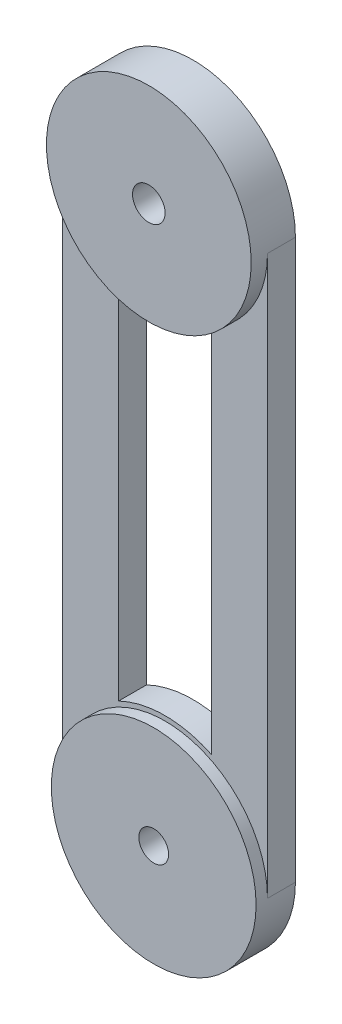
from build123d import *
from build123d.topology import SkipClean

# Parameters (mm, degrees)
BOSS_EXTRUDE1_DEPTH           = 3
BOSS_EXTRUDE2_START           = -1.75
SKETCH1_3_R                   = 11
BOSS_EXTRUDE2_DEPTH           = 1.75
SKETCH2_R                     = 1.75
CUT_EXTRUDE1_DEPTH            = 4.75
SKETCH2_3_R                   = 3
CUT_EXTRUDE2_DEPTH            = 1.75
BOSS_EXTRUDE3_START           = -1.225
SKETCH1_4_R                   = 11
BOSS_EXTRUDE3_DEPTH           = 1.225
SKETCH3_R                     = 1.6
CUT_EXTRUDE3_DEPTH            = 4.225
SKETCH3_3_R                   = 3
SKETCH3_3_R_2                 = 1.6
CUT_EXTRUDE4_DEPTH            = 1.225
BODY_MOVE_COPY1_DEPTH         = 3
BODY_MOVE_COPY1_START         = 1.75
BODY_MOVE_COPY1_2_OUTLINE_R   = 11
BODY_MOVE_COPY1_2_OUTLINE_R_2 = 1.6
BODY_MOVE_COPY1_2_OUTLINE_R_3 = 3
BODY_MOVE_COPY1_2_DEPTH       = 1.25
BODY_MOVE_COPY1_START_2       = 1.225
BODY_MOVE_COPY1_3_OUTLINE_R   = 11
BODY_MOVE_COPY1_3_OUTLINE_R_2 = 1.6
BODY_MOVE_COPY1_3_DEPTH       = 0.525
BODY_MOVE_COPY1_START_3       = -1.75
BODY_MOVE_COPY1_4_OUTLINE_R   = 3
BODY_MOVE_COPY1_4_OUTLINE_R_2 = 1.75
BODY_MOVE_COPY1_4_DEPTH       = 0.5
BODY_MOVE_COPY1_START_4       = -3
BODY_MOVE_COPY1_5_OUTLINE_R   = 3
BODY_MOVE_COPY1_5_DEPTH       = 3
BODY_MOVE_COPY1_START_5       = -1.775
BODY_MOVE_COPY1_6_OUTLINE_R   = 3
BODY_MOVE_COPY1_6_OUTLINE_R_2 = 1.6
BODY_MOVE_COPY1_6_DEPTH       = 0.55
BODY_MOVE_COPY1_START_6       = 1.25
BODY_MOVE_COPY1_7_OUTLINE_R   = 3
BODY_MOVE_COPY1_7_OUTLINE_R_2 = 1.75
BODY_MOVE_COPY1_7_DEPTH       = 0.5


# Read off the part's stored shape, not the designer's step: Body-Move/Copy1
with BuildPart() as part:
    # Sketch1 → Boss-Extrude1 (new body)
    with BuildSketch(Plane.XY):
        with BuildLine():
            Line((-11, 30), (-11, -30))
            ThreePointArc((-11, -30), (0, -41), (11, -30))
            Line((11, -30), (11, 30))
            ThreePointArc((11, 30), (0, 41), (-11, 30))
        make_face()
        with BuildLine():
            ThreePointArc((5, -19.643842411), (0, -18.5), (-5, -19.643842411))
            Line((-5, -19.643842411), (-5, 19.643842411))
            ThreePointArc((-5, 19.643842411), (0, 18.5), (5, 19.643842411))
            Line((5, 19.643842411), (5, -19.643842411))
        make_face(mode=Mode.SUBTRACT)
    extrude(amount=BOSS_EXTRUDE1_DEPTH)

    # Sketch1<3> → Boss-Extrude2 (add)
    with BuildSketch(Plane.XY.offset(BOSS_EXTRUDE2_START)):
        with Locations((0, 30)):
            Circle(SKETCH1_3_R)
    extrude(amount=BOSS_EXTRUDE2_DEPTH)

    # Sketch2 → Cut-Extrude1 (cut)
    with BuildSketch(Plane.XY.offset(3)):
        with Locations((0, 30)):
            Circle(SKETCH2_R)
    extrude(amount=-CUT_EXTRUDE1_DEPTH, mode=Mode.SUBTRACT)

    # Sketch2<3> → Cut-Extrude2 (cut)
    with BuildSketch(Plane.XY.offset(3)):
        with Locations((0, 30)):
            Circle(SKETCH2_3_R)
    extrude(amount=-CUT_EXTRUDE2_DEPTH, mode=Mode.SUBTRACT)

    # Sketch1<4> → Boss-Extrude3 (add)
    with SkipClean():  # the faces are left unmerged after this step: merging them gives an invalid solid
        with BuildSketch(Plane.XY.offset(BOSS_EXTRUDE3_START)):
            with Locations((0, -30)):
                Circle(SKETCH1_4_R)
        extrude(amount=BOSS_EXTRUDE3_DEPTH)

    # Sketch3 → Cut-Extrude3 (cut)
    with SkipClean():  # the faces are left unmerged after this step: merging them gives an invalid solid
        with BuildSketch(Plane.XY.offset(3)):
            with Locations((0, -30)):
                Circle(SKETCH3_R)
        extrude(amount=-CUT_EXTRUDE3_DEPTH, mode=Mode.SUBTRACT)

    # Sketch3<3> → Cut-Extrude4 (cut)
    with SkipClean():  # the faces are left unmerged after this step: merging them gives an invalid solid
        with BuildSketch(Plane.XY.offset(3)):
            with Locations((0, -30)):
                Circle(SKETCH3_3_R)
            with Locations((0, -30)):
                Circle(SKETCH3_3_R_2, mode=Mode.SUBTRACT)
        extrude(amount=-CUT_EXTRUDE4_DEPTH, mode=Mode.SUBTRACT)

    # Body-Move/Copy1 outline → Body-Move/Copy1 (cut)
    with SkipClean():  # the faces are left unmerged after this step: merging them gives an invalid solid
        with BuildSketch(Plane.XY):
            with BuildLine():
                Line((-11, 30), (-11, -30))
                ThreePointArc((-11, -30), (0, -19), (11, -30))
                Line((11, -30), (11, 30))
                ThreePointArc((11, 30), (0, 19), (-11, 30))
            make_face()
            with BuildLine():
                Line((-5, -19.643842411), (-5, 19.643842411))
                ThreePointArc((-5, 19.643842411), (0, 18.5), (5, 19.643842411))
                Line((5, 19.643842411), (5, -19.643842411))
                ThreePointArc((5, -19.643842411), (0, -18.5), (-5, -19.643842411))
            make_face(mode=Mode.SUBTRACT)
        extrude(amount=BODY_MOVE_COPY1_DEPTH, mode=Mode.SUBTRACT)

    # Body-Move_Copy1 2 outline → Body-Move_Copy1 2 (cut)
    # profile 1 of 2: a face of its own
    with SkipClean():  # the faces are left unmerged after this step: merging them gives an invalid solid
        with BuildSketch(Plane.XY.offset(BODY_MOVE_COPY1_START)):
            with Locations((0, -30)):
                Circle(BODY_MOVE_COPY1_2_OUTLINE_R)
            with Locations((0, -30)):
                Circle(BODY_MOVE_COPY1_2_OUTLINE_R_2, mode=Mode.SUBTRACT)
        # profile 2 of 2: a face of its own
        with BuildSketch(Plane.XY.offset(BODY_MOVE_COPY1_START)):
            with Locations((0, 30)):
                Circle(BODY_MOVE_COPY1_2_OUTLINE_R)
            with Locations((0, 30)):
                Circle(BODY_MOVE_COPY1_2_OUTLINE_R_3, mode=Mode.SUBTRACT)
        extrude(amount=BODY_MOVE_COPY1_2_DEPTH, mode=Mode.SUBTRACT)

    # Body-Move_Copy1 3 outline → Body-Move_Copy1 3 (cut)
    with SkipClean():  # the faces are left unmerged after this step: merging them gives an invalid solid
        with BuildSketch(Plane.XY.offset(BODY_MOVE_COPY1_START_2)):
            with Locations((0, -30)):
                Circle(BODY_MOVE_COPY1_3_OUTLINE_R)
            with Locations((0, -30)):
                Circle(BODY_MOVE_COPY1_3_OUTLINE_R_2, mode=Mode.SUBTRACT)
        extrude(amount=BODY_MOVE_COPY1_3_DEPTH, mode=Mode.SUBTRACT)

    # Body-Move_Copy1 4 outline → Body-Move_Copy1 4 (cut)
    with SkipClean():  # the faces are left unmerged after this step: merging them gives an invalid solid
        with BuildSketch(Plane.XY.offset(BODY_MOVE_COPY1_START_3)):
            with Locations((0, 30)):
                Circle(BODY_MOVE_COPY1_4_OUTLINE_R)
            with Locations((0, 30)):
                Circle(BODY_MOVE_COPY1_4_OUTLINE_R_2, mode=Mode.SUBTRACT)
        extrude(amount=BODY_MOVE_COPY1_4_DEPTH, mode=Mode.SUBTRACT)

    # Body-Move_Copy1 5 outline → Body-Move_Copy1 5 (add)
    with BuildSketch(Plane.XY.offset(BODY_MOVE_COPY1_START_4)):
        with BuildLine():
            Line((-11, 30), (-11, -30))
            ThreePointArc((-11, -30), (0, -41), (11, -30))
            Line((11, -30), (11, 30))
            ThreePointArc((11, 30), (0, 41), (-11, 30))
        make_face()
        with BuildLine():
            Line((-5, -19.643842411), (-5, 19.643842411))
            ThreePointArc((-5, 19.643842411), (0, 18.5), (5, 19.643842411))
            Line((5, 19.643842411), (5, -19.643842411))
            ThreePointArc((5, -19.643842411), (0, -18.5), (-5, -19.643842411))
        make_face(mode=Mode.SUBTRACT)
        with Locations((0, 30)):
            Circle(BODY_MOVE_COPY1_5_OUTLINE_R, mode=Mode.SUBTRACT)
        with Locations((0, -30)):
            Circle(BODY_MOVE_COPY1_5_OUTLINE_R, mode=Mode.SUBTRACT)
    extrude(amount=BODY_MOVE_COPY1_5_DEPTH)

    # Body-Move_Copy1 6 outline → Body-Move_Copy1 6 (add)
    with SkipClean():  # the faces are left unmerged after this step: merging them gives an invalid solid
        with BuildSketch(Plane.XY.offset(BODY_MOVE_COPY1_START_5)):
            with Locations((0, -30)):
                Circle(BODY_MOVE_COPY1_6_OUTLINE_R)
            with Locations((0, -30)):
                Circle(BODY_MOVE_COPY1_6_OUTLINE_R_2, mode=Mode.SUBTRACT)
        extrude(amount=BODY_MOVE_COPY1_6_DEPTH)

    # Body-Move_Copy1 7 outline → Body-Move_Copy1 7 (add)
    with BuildSketch(Plane.XY.offset(BODY_MOVE_COPY1_START_6)):
        with Locations((0, 30)):
            Circle(BODY_MOVE_COPY1_7_OUTLINE_R)
        with Locations((0, 30)):
            Circle(BODY_MOVE_COPY1_7_OUTLINE_R_2, mode=Mode.SUBTRACT)
    extrude(amount=BODY_MOVE_COPY1_7_DEPTH)


solid = part.part
